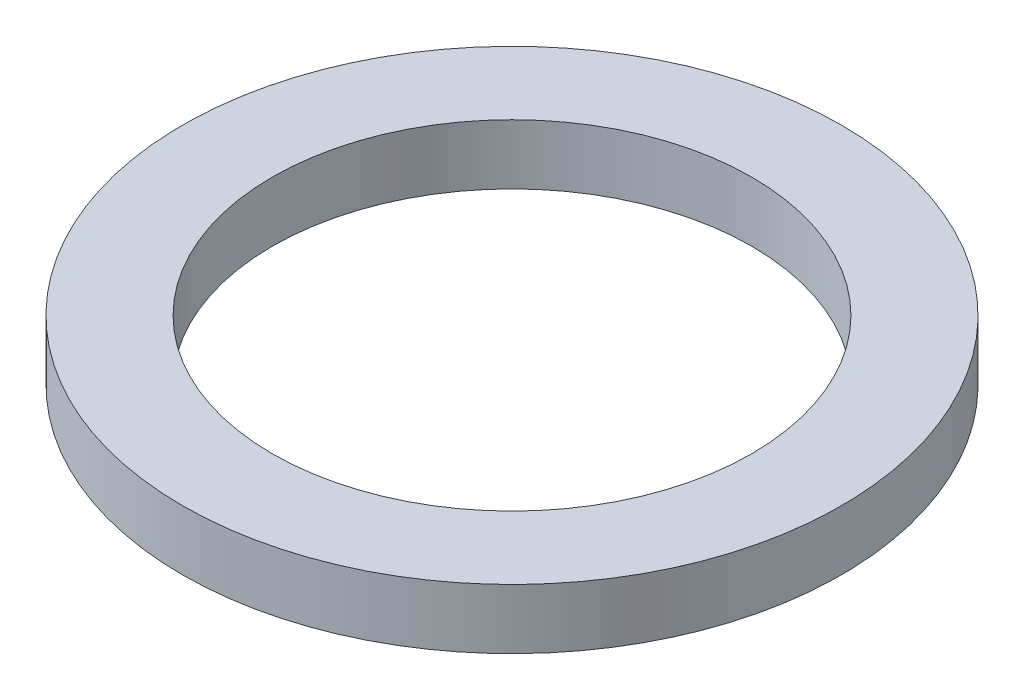
from build123d import *

# Parameters (mm, degrees)
SKETCH1_R           = 5.5
SKETCH1_R_2         = 4
BOSS_EXTRUDE1_DEPTH = 0.5


with BuildPart() as part:
    # Sketch1 → Boss-Extrude1 (new, symmetric)
    with BuildSketch(Plane(origin=(0, 0, 0), x_dir=(1, 0, 0), z_dir=(0, 1, 0))):
        Circle(SKETCH1_R)
        Circle(SKETCH1_R_2, mode=Mode.SUBTRACT)
    extrude(amount=BOSS_EXTRUDE1_DEPTH, both=True)


solid = part.part
